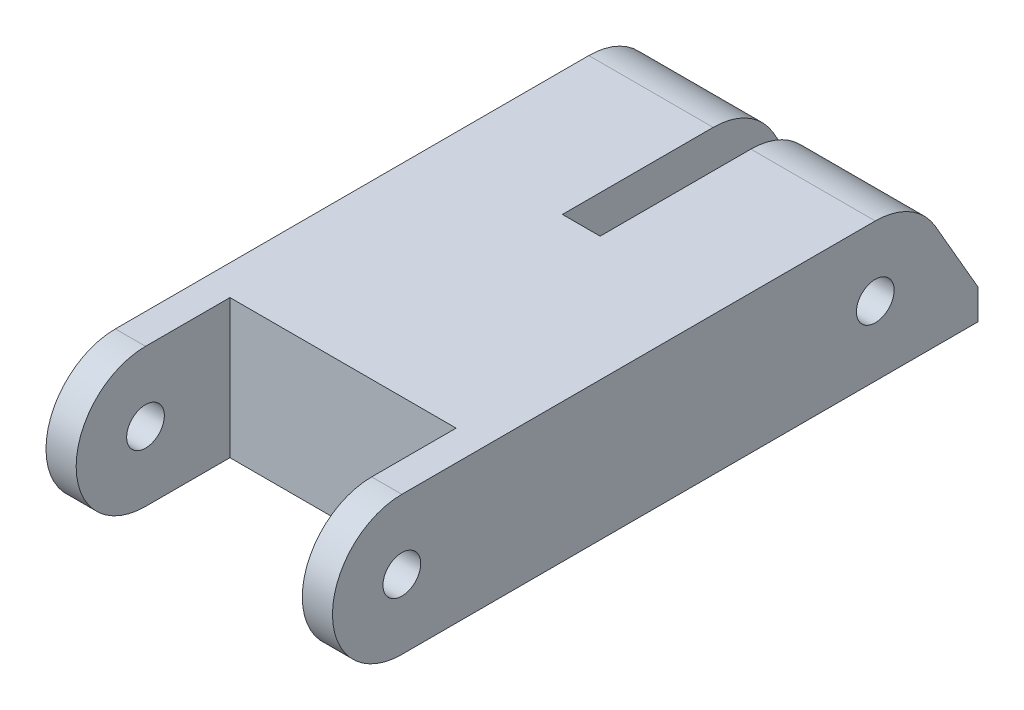
from build123d import *

# Parameters (mm, degrees)
SKETCH1_R          = 0.79375
EXTRUDE1_DEPTH     = 6.0325
SKETCH2_W          = 9.525
SKETCH2_H          = 6.477
CUT_EXTRUDE1_DEPTH = 25.353636695
FILLET1_R          = 2.921
EXTRUDE2_DEPTH     = 12.065
SKETCH5_W          = 1.5875
SKETCH5_H          = 10.676085567
CUT_EXTRUDE2_DEPTH = 4.572


with BuildPart() as part:
    # Sketch1 → Extrude1 (new, symmetric)
    with BuildSketch(Plane(origin=(0, 0, 0), x_dir=(0, 0, -1), z_dir=(1, 0, 0))):
        with BuildLine():
            Line((0, 2.921), (22.86, 2.921))
            Line((22.86, 2.921), (22.86, -2.921))
            Line((22.86, -2.921), (0, -2.921))
            ThreePointArc((0, -2.921), (-2.921, 0), (0, 2.921))
        make_face()
        with Locations(Location((0, 0, 0), (0, 0, 180))):
            Circle(SKETCH1_R, mode=Mode.SUBTRACT)
        with Locations(Location((19.939, 0, 0), (0, 0, 180))):
            Circle(SKETCH1_R, mode=Mode.SUBTRACT)
    extrude(amount=EXTRUDE1_DEPTH, both=True)

    # Sketch2 → Cut-Extrude1 (cut, through all)
    with BuildSketch(Plane(origin=(0, 2.921, 0), x_dir=(-1, 0, 0), z_dir=(0, 1, 0))):
        with Locations((0, -0.3175)):
            Rectangle(SKETCH2_W, SKETCH2_H)
    extrude(amount=-CUT_EXTRUDE1_DEPTH, mode=Mode.SUBTRACT)

    # Fillet1
    fillet1_edges = [part.edges().sort_by_distance(p)[0] for p in [
        (0, 2.921, -22.86),
        (0, -2.921, -22.86),
    ]]
    fillet(fillet1_edges, radius=FILLET1_R - 0.0001)  # a hair under: the kernel refuses the full size

    # Sketch3 → Extrude2 (add)
    with BuildSketch(Plane(origin=(6.0325, 0, 0), x_dir=(0, 0, -1), z_dir=(1, 0, 0))):
        with BuildLine():
            Line((22.468660204, 1.4605), (24.265085567, -1.651))
            Line((24.265085567, -1.651), (24.265085567, -2.921))
            Line((24.265085567, -2.921), (19.939, -2.921))
            ThreePointArc((19.939, -2.921), (22.004458908, -2.065458908), (22.86, 0))
            ThreePointArc((22.86, 0), (22.760469339, 0.756010431), (22.468660204, 1.4605))
        make_face()
    extrude(amount=-EXTRUDE2_DEPTH)

    # Sketch5 → Cut-Extrude2 (cut)
    with BuildSketch(Plane(origin=(0, 2.921, 0), x_dir=(-1, 0, 0), z_dir=(0, 1, 0))):
        with Locations((0, -18.927042783)):
            Rectangle(SKETCH5_W, SKETCH5_H)
    extrude(amount=-CUT_EXTRUDE2_DEPTH, mode=Mode.SUBTRACT)


solid = part.part
